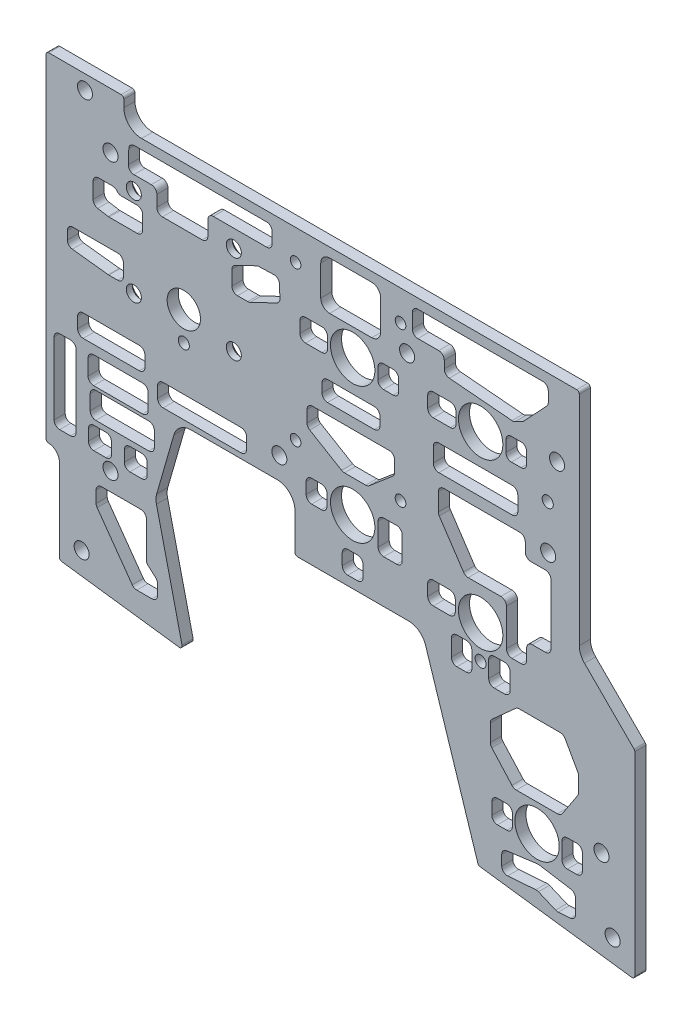
from build123d import *

# Parameters (mm, degrees)
BOSS_EXTRUDE1_DEPTH                       = 3.175
F_6_CLEARANCE_HOLE1_D                     = 4.3053
SKETCH4_R                                 = 6.35
SKETCH4_R_2                               = 1.5875
SKETCH4_R_3                               = 4.7625
CUT_EXTRUDE1_DEPTH                        = 218.405084842
CSK_FOR_6_FLAT_HEAD_MACHINE_SCREW_2_COUNT = 2
CSK_FOR_6_FLAT_HEAD_MACHINE_SCREW_2_PITCH = 28.575
CSK_FOR_6_FLAT_HEAD_MACHINE_SCREW_3_COUNT = 2
CSK_FOR_6_FLAT_HEAD_MACHINE_SCREW_3_PITCH = 38.232062788
CSK_FOR_6_FLAT_HEAD_MACHINE_SCREW_4_COUNT = 2
CSK_FOR_6_FLAT_HEAD_MACHINE_SCREW_4_PITCH = 25.4
F_0_CLEARANCE_HOLE1_D                     = 1.8542
F_1_8_0_125_DIAMETER_HOLE1_D              = 3.175
SKETCH17_R                                = 1.5875
BACKLIGHTING_HOLES_DEPTH                  = 218.405084842
SKETCH20_R                                = 1.52
SKETCH20_R_2                              = 1.520000008
SWITCH_PCB_MOUNTING_HOLES_DEPTH           = 218.405084844


with BuildPart() as part:
    # Sketch1 → Boss-Extrude1 (new body)
    with BuildSketch(Plane.XY):
        with BuildLine():
            Line((3.809986215, -91.884500325), (3.80998361, -115.403340545))
            ThreePointArc((3.80998361, -115.403340545), (3.999081622, -115.90576205), (4.472522544, -116.158821571))
            Line((4.472522544, -116.158821571), (38.023104274, -120.5758443))
            ThreePointArc((38.023104274, -120.5758443), (38.687459595, -120.33177166), (38.864463259, -119.646491316))
            Line((38.864463259, -119.646491316), (31.544635998, -88.413376307))
            ThreePointArc((31.544635998, -88.413376307), (31.412233483, -87.126289027), (31.609278422, -85.84750156))
            Line((31.609278422, -85.84750156), (36.533410401, -68.760772014))
            ThreePointArc((36.533410401, -68.760772014), (38.360231081, -66.108400459), (41.414754107, -65.0875))
            Line((41.414754107, -65.0875), (66.039990754, -65.0875))
            ThreePointArc((66.039990754, -65.0875), (69.632093202, -66.575397552), (71.119990754, -70.1675))
            Line((71.119990754, -70.1675), (71.119990754, -80.518))
            ThreePointArc((71.119990754, -80.518), (71.343175387, -81.056815367), (71.881990754, -81.28))
            Line((71.881990754, -81.28), (103.612235862, -81.28))
            ThreePointArc((103.612235862, -81.28), (106.604490402, -82.25478225), (108.448399818, -84.805034342))
            Line((108.448399818, -84.805034342), (123.423319929, -131.379161885))
            ThreePointArc((123.423319929, -131.379161885), (123.660593225, -131.731025839), (124.049283564, -131.901398021))
            Line((124.049283564, -131.901398021), (167.413526593, -137.610408921))
            ThreePointArc((167.413526593, -137.610408921), (168.015409063, -137.42782987), (168.274987552, -136.854927937))
            Line((168.274987552, -136.854927937), (168.274987552, -81.303553632))
            ThreePointArc((168.274987552, -81.303553632), (168.216983776, -81.011948907), (168.051802995, -80.764738341))
            Line((168.051802995, -80.764738341), (153.88788809, -66.600819412))
            ThreePointArc((153.88788809, -66.600819412), (152.786682817, -64.952748811), (152.399991049, -63.008717113))
            Line((152.399991049, -63.008717113), (152.399999892, -0.762021595))
            ThreePointArc((152.399999892, -0.762021595), (152.176815316, -0.223206231), (151.638, -2.1541e-05))
            Line((151.638, -2.1541e-05), (27.305, -3.804e-06))
            ThreePointArc((27.305, -3.804e-06), (23.712898123, 1.487894033), (22.22500087, 5.079996121))
            Line((22.22500087, 5.079996121), (22.225001755, 7.175496897))
            ThreePointArc((22.225001755, 7.175496897), (22.001816945, 7.7143128), (21.463001073, 7.937498421))
            Line((21.463001073, 7.937498421), (0.762001075, 7.937499892))
            ThreePointArc((0.762001075, 7.937499892), (0.223185691, 7.714315297), (1.021e-06, 7.175499945))
            Line((1.021e-06, 7.175499945), (-1.2342e-05, -87.949548922))
            ThreePointArc((-1.2342e-05, -87.949548922), (0.214550622, -88.479602508), (0.737406874, -88.711153328))
            ThreePointArc((0.737406874, -88.711153328), (2.915974038, -89.675944454), (3.809986215, -91.884500325))
        make_face()
    extrude(amount=-BOSS_EXTRUDE1_DEPTH)

    # #6 Clearance Hole1 (through all)
    with Locations(Plane(origin=(0, 0, -3.175), x_dir=(-1, 0, 0), z_dir=(0, 0, -1))):
        with Locations((-11.112500541, 3.81), (-18.414998872, -7.937503157), (-103.187497835, -15.240014658), (-143.510001128, -44.450020387), (-158.750001128, -111.125021649), (-18.414987678, -86.741003157), (-66.674991751, -58.7375), (-10.16, -110.502822935), (-146.049997068, -20.637520747), (-161.924987552, -130.483035149)):
            Hole(F_6_CLEARANCE_HOLE1_D / 2)

    # Sketch4 → Cut-Extrude1 (cut, through all)
    with BuildSketch(Plane(origin=(0, 0, -3.175), x_dir=(-1, 0, 0), z_dir=(0, 0, -1))):
        with Locations((-140.334987552, -115.57)):
            Circle(SKETCH4_R)
        with Locations((-124.205996572, -71.437521424)):
            Circle(SKETCH4_R)
        with Locations((-87.63, -62.992021649)):
            Circle(SKETCH4_R)
        with Locations((-87.63, -24.130021649)):
            Circle(SKETCH4_R)
        with Locations((-124.205996572, -24.130021649)):
            Circle(SKETCH4_R)
        with Locations((-124.205996572, -80.962521424)):
            Circle(SKETCH4_R_2)
        with Locations((-39.36999484, -36.322003157)):
            Circle(SKETCH4_R_3)
    extrude(amount=-CUT_EXTRUDE1_DEPTH, mode=Mode.SUBTRACT)

    # Sketch5 → CSK for #6 Flat Head Machine Screw (100)1 (revolve, cut)
    with BuildSketch(Plane(origin=(53.65749484, -14.097003157, -3.175), x_dir=(0, 1, 0), z_dir=(1, 0, 0))):
        Polygon((0, 0), (0, 3.175), (2.15265, 3.175), (2.15265, 1.420893136), (3.8460045, 0), align=None)
    csk_for_6_flat_head_machine_screw_100 = revolve(axis=Axis((53.65749484, -14.097003157, -9.525), (0, 0, 1)), mode=Mode.SUBTRACT)

    # CSK for _6 Flat Head Machine Screw _ 2: CSK for #6 Flat Head Machine Screw (100)1 ×2
    with Locations(*[(-i * CSK_FOR_6_FLAT_HEAD_MACHINE_SCREW_2_PITCH, 0, 0) for i in range(1, CSK_FOR_6_FLAT_HEAD_MACHINE_SCREW_2_COUNT)]):
        add(csk_for_6_flat_head_machine_screw_100, mode=Mode.SUBTRACT)

    # CSK for _6 Flat Head Machine Screw _ 3: CSK for #6 Flat Head Machine Screw (100)1 ×2
    with Locations(*[Vector(-0.7474093186836602, -0.6643638388299193, 0) * (i * CSK_FOR_6_FLAT_HEAD_MACHINE_SCREW_3_PITCH) for i in range(1, CSK_FOR_6_FLAT_HEAD_MACHINE_SCREW_3_COUNT)]):
        add(csk_for_6_flat_head_machine_screw_100, mode=Mode.SUBTRACT)

    # CSK for _6 Flat Head Machine Screw _ 4: CSK for #6 Flat Head Machine Screw (100)1 ×2
    with Locations(*[(0, -i * CSK_FOR_6_FLAT_HEAD_MACHINE_SCREW_4_PITCH, 0) for i in range(1, CSK_FOR_6_FLAT_HEAD_MACHINE_SCREW_4_COUNT)]):
        add(csk_for_6_flat_head_machine_screw_100, mode=Mode.SUBTRACT)

    # #0 Clearance Hole1 (through all)
    with Locations(Plane(origin=(0, 0, -9.525), x_dir=(-1, 0, 0), z_dir=(0, 0, -1))):
        with Locations((-39.36999484, -44.577003157)):
            Hole(F_0_CLEARANCE_HOLE1_D / 2)

    # 1/8 (0.125) Diameter Hole1 (through all)
    with Locations(Plane.XY):
        with Locations((39.36999484, -44.577003157)):
            Hole(F_1_8_0_125_DIAMETER_HOLE1_D / 2)

    # Sketch17 → Backlighting Holes (cut, through all)
    with BuildSketch(Plane(origin=(0, 0, 0), x_dir=(-1, 0, 0), z_dir=(0, 0, -1))):
        with Locations((-143.386523366, -31.863003467)):
            Circle(SKETCH17_R)
        with BuildLine():
            Line((-141.954401082, -2.794778722), (-106.266230354, -2.794778722))
            ThreePointArc((-106.266230354, -2.794778722), (-105.143698339, -3.259746707), (-104.678730354, -4.382278722))
            Line((-104.678730354, -4.382278722), (-104.678730354, -8.460645735))
            ThreePointArc((-104.678730354, -8.460645735), (-105.143698339, -9.58317775), (-106.266230354, -10.048145735))
            Line((-106.266230354, -10.048145735), (-112.220916292, -10.048145735))
            ThreePointArc((-112.220916292, -10.048145735), (-113.343448308, -10.513113719), (-113.808416292, -11.635645735))
            Line((-113.808416292, -11.635645735), (-113.808416292, -13.776242931))
            ThreePointArc((-113.808416292, -13.776242931), (-114.2259722, -14.849269991), (-115.258982682, -15.357826136))
            Line((-115.258982682, -15.357826136), (-133.159037644, -16.907614445))
            ThreePointArc((-133.159037644, -16.907614445), (-133.597603316, -16.884612116), (-134.01308492, -16.742330728))
            Line((-134.01308492, -16.742330728), (-136.087372049, -15.692058763))
            ThreePointArc((-136.087372049, -15.692058763), (-136.323169987, -15.545450468), (-136.529817195, -15.360000768))
            Line((-136.529817195, -15.360000768), (-143.113959892, -8.318487666))
            ThreePointArc((-143.113959892, -8.318487666), (-143.431045227, -7.817065459), (-143.541901082, -7.234246174))
            Line((-143.541901082, -7.234246174), (-143.541901082, -4.382278722))
            ThreePointArc((-143.541901082, -4.382278722), (-143.076933097, -3.259746707), (-141.954401082, -2.794778722))
        make_face()
        with BuildLine():
            Line((-93.066886854, -2.707621709), (-81.044131338, -2.707621709))
            ThreePointArc((-81.044131338, -2.707621709), (-79.248080114, -3.451570485), (-78.504131338, -5.247621709))
            Line((-78.504131338, -5.247621709), (-78.504131338, -13.895603213))
            ThreePointArc((-78.504131338, -13.895603213), (-79.248080114, -15.691654437), (-81.044131338, -16.435603213))
            Line((-81.044131338, -16.435603213), (-93.066886854, -16.435603213))
            ThreePointArc((-93.066886854, -16.435603213), (-94.862938078, -15.691654437), (-95.606886854, -13.895603213))
            Line((-95.606886854, -13.895603213), (-95.606886854, -5.247621709))
            ThreePointArc((-95.606886854, -5.247621709), (-94.862938078, -3.451570485), (-93.066886854, -2.707621709))
        make_face()
        with BuildLine():
            Line((-72.561223983, -22.437005333), (-72.561223983, -25.636983817))
            ThreePointArc((-72.561223983, -25.636983817), (-73.026191968, -26.759515832), (-74.148723983, -27.224483817))
            Line((-74.148723983, -27.224483817), (-78.851026484, -27.224483817))
            ThreePointArc((-78.851026484, -27.224483817), (-79.973558499, -26.759515832), (-80.438526484, -25.636983817))
            Line((-80.438526484, -25.636983817), (-80.438526484, -22.437005333))
            ThreePointArc((-80.438526484, -22.437005333), (-79.973558499, -21.314473318), (-78.851026484, -20.849505333))
            Line((-78.851026484, -20.849505333), (-74.148723983, -20.849505333))
            ThreePointArc((-74.148723983, -20.849505333), (-73.026191968, -21.314473318), (-72.561223983, -22.437005333))
        make_face()
        with BuildLine():
            Line((-99.201764697, -21.196263474), (-96.421279554, -21.196263474))
            ThreePointArc((-96.421279554, -21.196263474), (-95.298747539, -21.661231459), (-94.833779554, -22.783763474))
            Line((-94.833779554, -22.783763474), (-94.833779554, -25.981791856))
            ThreePointArc((-94.833779554, -25.981791856), (-95.298747539, -27.104323871), (-96.421279554, -27.569291856))
            Line((-96.421279554, -27.569291856), (-99.201764697, -27.569291856))
            ThreePointArc((-99.201764697, -27.569291856), (-100.324296712, -27.104323871), (-100.789264697, -25.981791856))
            Line((-100.789264697, -25.981791856), (-100.789264697, -22.783763474))
            ThreePointArc((-100.789264697, -22.783763474), (-100.324296712, -21.661231459), (-99.201764697, -21.196263474))
        make_face()
        with BuildLine():
            Line((-109.079202691, -22.654901792), (-109.079202691, -25.854880276))
            ThreePointArc((-109.079202691, -25.854880276), (-109.544170675, -26.977412291), (-110.666702691, -27.442380276))
            Line((-110.666702691, -27.442380276), (-115.553648816, -27.442380276))
            ThreePointArc((-115.553648816, -27.442380276), (-116.676180832, -26.977412291), (-117.141148816, -25.854880276))
            Line((-117.141148816, -25.854880276), (-117.141148816, -22.654901792))
            ThreePointArc((-117.141148816, -22.654901792), (-116.676180832, -21.532369777), (-115.553648816, -21.067401792))
            Line((-115.553648816, -21.067401792), (-110.666702691, -21.067401792))
            ThreePointArc((-110.666702691, -21.067401792), (-109.544170675, -21.532369777), (-109.079202691, -22.654901792))
        make_face()
        with BuildLine():
            Line((-135.77376345, -20.881443358), (-132.993278308, -20.881443358))
            ThreePointArc((-132.993278308, -20.881443358), (-131.870746293, -21.346411343), (-131.405778308, -22.468943358))
            Line((-131.405778308, -22.468943358), (-131.405778308, -25.666971739))
            ThreePointArc((-131.405778308, -25.666971739), (-131.870746293, -26.789503754), (-132.993278308, -27.254471739))
            Line((-132.993278308, -27.254471739), (-135.77376345, -27.254471739))
            ThreePointArc((-135.77376345, -27.254471739), (-136.896295465, -26.789503754), (-137.36126345, -25.666971739))
            Line((-137.36126345, -25.666971739), (-137.36126345, -22.468943358))
            ThreePointArc((-137.36126345, -22.468943358), (-136.896295465, -21.346411343), (-135.77376345, -20.881443358))
        make_face()
        with BuildLine():
            Line((-93.818924612, -33.08533813), (-80.438526484, -33.08533813))
            ThreePointArc((-80.438526484, -33.08533813), (-79.315994469, -33.550306115), (-78.851026484, -34.67283813))
            Line((-78.851026484, -34.67283813), (-78.851026484, -37.195409517))
            ThreePointArc((-78.851026484, -37.195409517), (-79.315994469, -38.317941532), (-80.438526484, -38.782909517))
            Line((-80.438526484, -38.782909517), (-93.818924612, -38.782909517))
            ThreePointArc((-93.818924612, -38.782909517), (-94.941456627, -38.317941532), (-95.406424612, -37.195409517))
            Line((-95.406424612, -37.195409517), (-95.406424612, -34.67283813))
            ThreePointArc((-95.406424612, -34.67283813), (-94.941456627, -33.550306115), (-93.818924612, -33.08533813))
        make_face()
        with BuildLine():
            Line((-133.234599807, -32.906340689), (-112.254202691, -32.906340689))
            ThreePointArc((-112.254202691, -32.906340689), (-111.131670675, -33.371308674), (-110.666702691, -34.493840689))
            Line((-110.666702691, -34.493840689), (-110.666702691, -38.654468066))
            ThreePointArc((-110.666702691, -38.654468066), (-111.131670675, -39.777000081), (-112.254202691, -40.241968066))
            Line((-112.254202691, -40.241968066), (-133.234599807, -40.241968066))
            ThreePointArc((-133.234599807, -40.241968066), (-134.357131822, -39.777000081), (-134.822099807, -38.654468066))
            Line((-134.822099807, -38.654468066), (-134.822099807, -34.493840689))
            ThreePointArc((-134.822099807, -34.493840689), (-134.357131822, -33.371308674), (-133.234599807, -32.906340689))
        make_face()
        with BuildLine():
            Line((-98.049772798, -41.846894397), (-76.171732084, -41.846894397))
            ThreePointArc((-76.171732084, -41.846894397), (-75.049200069, -42.311862382), (-74.584232084, -43.434394397))
            Line((-74.584232084, -43.434394397), (-74.584232084, -46.777135575))
            ThreePointArc((-74.584232084, -46.777135575), (-74.791626469, -47.561651185), (-75.359620735, -48.14118521))
            Line((-75.359620735, -48.14118521), (-84.465669031, -53.562633937))
            ThreePointArc((-84.465669031, -53.562633937), (-84.856634648, -53.729202648), (-85.277780379, -53.786084302))
            Line((-85.277780379, -53.786084302), (-91.347435578, -53.786084302))
            ThreePointArc((-91.347435578, -53.786084302), (-91.895147409, -53.68860712), (-92.375596997, -53.408146349))
            Line((-92.375596997, -53.408146349), (-99.077934217, -47.710973092))
            ThreePointArc((-99.077934217, -47.710973092), (-99.490668787, -47.167725534), (-99.637272798, -46.501411045))
            Line((-99.637272798, -46.501411045), (-99.637272798, -43.434394397))
            ThreePointArc((-99.637272798, -43.434394397), (-99.172304813, -42.311862382), (-98.049772798, -41.846894397))
        make_face()
        with BuildLine():
            Line((-135.378861596, -43.434394397), (-113.69903477, -43.434394397))
            ThreePointArc((-113.69903477, -43.434394397), (-112.576502755, -43.899362382), (-112.11153477, -45.021894397))
            Line((-112.11153477, -45.021894397), (-112.11153477, -50.042866363))
            ThreePointArc((-112.11153477, -50.042866363), (-112.179838766, -50.503517806), (-112.37887304, -50.924529143))
            Line((-112.37887304, -50.924529143), (-119.322930241, -61.322244422))
            ThreePointArc((-119.322930241, -61.322244422), (-119.894587933, -61.840545197), (-120.64309197, -62.028081642))
            Line((-120.64309197, -62.028081642), (-129.987144718, -62.028081642))
            ThreePointArc((-129.987144718, -62.028081642), (-131.109676734, -62.493049627), (-131.574644718, -63.615581642))
            Line((-131.574644718, -63.615581642), (-131.574644718, -74.171525295))
            ThreePointArc((-131.574644718, -74.171525295), (-132.039612703, -75.29405731), (-133.162144718, -75.759025295))
            Line((-133.162144718, -75.759025295), (-135.77376345, -75.759025295))
            ThreePointArc((-135.77376345, -75.759025295), (-136.896295465, -75.29405731), (-137.36126345, -74.171525295))
            Line((-137.36126345, -74.171525295), (-137.36126345, -71.06167269))
            ThreePointArc((-137.36126345, -71.06167269), (-137.826231435, -69.939140675), (-138.94876345, -69.47417269))
            Line((-138.94876345, -69.47417269), (-142.70584419, -69.47417269))
            ThreePointArc((-142.70584419, -69.47417269), (-143.828376205, -69.009204705), (-144.29334419, -67.88667269))
            Line((-144.29334419, -67.88667269), (-144.29334419, -50.696173086))
            ThreePointArc((-144.29334419, -50.696173086), (-143.828376205, -49.573641071), (-142.70584419, -49.108673086))
            Line((-142.70584419, -49.108673086), (-138.553861596, -49.108673086))
            ThreePointArc((-138.553861596, -49.108673086), (-137.431329581, -48.643705101), (-136.966361596, -47.521173086))
            Line((-136.966361596, -47.521173086), (-136.966361596, -45.021894397))
            ThreePointArc((-136.966361596, -45.021894397), (-136.501393611, -43.899362382), (-135.378861596, -43.434394397))
        make_face()
        with BuildLine():
            Line((-55.728459479, -57.317644253), (-33.458660867, -57.317644253))
            ThreePointArc((-33.458660867, -57.317644253), (-32.336128852, -57.782612238), (-31.871160867, -58.905144253))
            Line((-31.871160867, -58.905144253), (-31.871160867, -62.020016774))
            ThreePointArc((-31.871160867, -62.020016774), (-32.336128852, -63.142548789), (-33.458660867, -63.607516774))
            Line((-33.458660867, -63.607516774), (-55.728459479, -63.607516774))
            ThreePointArc((-55.728459479, -63.607516774), (-56.850991494, -63.142548789), (-57.315959479, -62.020016774))
            Line((-57.315959479, -62.020016774), (-57.315959479, -58.905144253))
            ThreePointArc((-57.315959479, -58.905144253), (-56.850991494, -57.782612238), (-55.728459479, -57.317644253))
        make_face()
        with BuildLine():
            Line((-78.702060135, -59.817431846), (-75.921574993, -59.817431846))
            ThreePointArc((-75.921574993, -59.817431846), (-74.799042977, -60.282399831), (-74.334074993, -61.404931846))
            Line((-74.334074993, -61.404931846), (-74.334074993, -64.602960227))
            ThreePointArc((-74.334074993, -64.602960227), (-74.799042977, -65.725492242), (-75.921574993, -66.190460227))
            Line((-75.921574993, -66.190460227), (-78.702060135, -66.190460227))
            ThreePointArc((-78.702060135, -66.190460227), (-79.82459215, -65.725492242), (-80.289560135, -64.602960227))
            Line((-80.289560135, -64.602960227), (-80.289560135, -61.404931846))
            ThreePointArc((-80.289560135, -61.404931846), (-79.82459215, -60.282399831), (-78.702060135, -59.817431846))
        make_face()
        with BuildLine():
            Line((-89.018858203, -72.254815082), (-86.23837306, -72.254815082))
            ThreePointArc((-86.23837306, -72.254815082), (-85.115841045, -72.719783067), (-84.65087306, -73.842315082))
            Line((-84.65087306, -73.842315082), (-84.65087306, -77.040343463))
            ThreePointArc((-84.65087306, -77.040343463), (-85.115841045, -78.162875478), (-86.23837306, -78.627843463))
            Line((-86.23837306, -78.627843463), (-89.018858203, -78.627843463))
            ThreePointArc((-89.018858203, -78.627843463), (-90.141390218, -78.162875478), (-90.606358203, -77.040343463))
            Line((-90.606358203, -77.040343463), (-90.606358203, -73.842315082))
            ThreePointArc((-90.606358203, -73.842315082), (-90.141390218, -72.719783067), (-89.018858203, -72.254815082))
        make_face()
        with BuildLine():
            Line((-109.075626661, -69.247984793), (-109.075626661, -72.447963277))
            ThreePointArc((-109.075626661, -72.447963277), (-109.540594645, -73.570495292), (-110.663126661, -74.035463277))
            Line((-110.663126661, -74.035463277), (-115.365429161, -74.035463277))
            ThreePointArc((-115.365429161, -74.035463277), (-116.487961176, -73.570495292), (-116.952929161, -72.447963277))
            Line((-116.952929161, -72.447963277), (-116.952929161, -69.247984793))
            ThreePointArc((-116.952929161, -69.247984793), (-116.487961176, -68.125452778), (-115.365429161, -67.660484793))
            Line((-115.365429161, -67.660484793), (-110.663126661, -67.660484793))
            ThreePointArc((-110.663126661, -67.660484793), (-109.540594645, -68.125452778), (-109.075626661, -69.247984793))
        make_face()
        with BuildLine():
            Line((-148.370050761, -88.076585208), (-151.957151361, -94.466108152))
            ThreePointArc((-151.957151361, -94.466108152), (-152.115789699, -94.859097254), (-152.169841465, -95.27943636))
            Line((-152.169841465, -95.27943636), (-152.169841465, -99.49161714))
            ThreePointArc((-152.169841465, -99.49161714), (-152.099935986, -99.968481356), (-151.89610216, -100.405217006))
            Line((-151.89610216, -100.405217006), (-147.55983031, -106.991698188))
            ThreePointArc((-147.55983031, -106.991698188), (-146.96032319, -107.540670714), (-146.17213864, -107.739529297))
            Line((-146.17213864, -107.739529297), (-134.392603774, -107.739529297))
            ThreePointArc((-134.392603774, -107.739529297), (-133.716535226, -107.595755795), (-133.157475142, -107.189318439))
            Line((-133.157475142, -107.189318439), (-127.395632153, -100.784991214))
            ThreePointArc((-127.395632153, -100.784991214), (-127.07956224, -100.268864333), (-126.96932981, -99.673771097))
            Line((-126.96932981, -99.673771097), (-126.96932981, -94.86683815))
            ThreePointArc((-126.96932981, -94.86683815), (-127.113103312, -94.190769602), (-127.519540668, -93.631709518))
            Line((-127.519540668, -93.631709518), (-134.162932699, -87.654784784))
            ThreePointArc((-134.162932699, -87.654784784), (-134.67905958, -87.338714871), (-135.274152816, -87.228482441))
            Line((-135.274152816, -87.228482441), (-146.92130989, -87.228482441))
            ThreePointArc((-146.92130989, -87.228482441), (-147.760673997, -87.456100045), (-148.370050761, -88.076585208))
        make_face()
        with BuildLine():
            Line((-132.626442112, -79.356885677), (-132.626442112, -84.055009483))
            ThreePointArc((-132.626442112, -84.055009483), (-132.161474127, -85.177541498), (-131.038942112, -85.642509483))
            Line((-131.038942112, -85.642509483), (-128.087367926, -85.642509483))
            ThreePointArc((-128.087367926, -85.642509483), (-126.964835911, -85.177541498), (-126.499867926, -84.055009483))
            Line((-126.499867926, -84.055009483), (-126.499867926, -79.36528336))
            ThreePointArc((-126.499867926, -79.36528336), (-126.963240164, -78.244349364), (-128.082851263, -77.777789785))
            Line((-128.082851263, -77.777789785), (-131.034425449, -77.769392102))
            ThreePointArc((-131.034425449, -77.769392102), (-132.159876108, -78.232757914), (-132.626442112, -79.356885677))
        make_face()
        with BuildLine():
            Line((-121.693780245, -79.413986581), (-121.693780245, -84.111339186))
            ThreePointArc((-121.693780245, -84.111339186), (-121.22881226, -85.233871201), (-120.106280245, -85.698839186))
            Line((-120.106280245, -85.698839186), (-117.42576388, -85.698839186))
            ThreePointArc((-117.42576388, -85.698839186), (-116.303231865, -85.233871201), (-115.83826388, -84.111339186))
            Line((-115.83826388, -84.111339186), (-115.83826388, -79.421613063))
            ThreePointArc((-115.83826388, -79.421613063), (-116.301636118, -78.300679067), (-117.421247217, -77.834119488))
            Line((-117.421247217, -77.834119488), (-120.101763581, -77.826493007))
            ThreePointArc((-120.101763581, -77.826493007), (-121.227214241, -78.289858819), (-121.693780245, -79.413986581))
        make_face()
        with BuildLine():
            Line((-101.797793639, -60.937531848), (-101.797793639, -67.347277648))
            ThreePointArc((-101.797793639, -67.347277648), (-101.332825654, -68.469809663), (-100.210293639, -68.934777648))
            Line((-100.210293639, -68.934777648), (-96.497621556, -68.934777648))
            ThreePointArc((-96.497621556, -68.934777648), (-95.375089541, -68.469809663), (-94.910121556, -67.347277648))
            Line((-94.910121556, -67.347277648), (-94.910121556, -60.948094972))
            ThreePointArc((-94.910121556, -60.948094972), (-95.373493794, -59.827160976), (-96.493104893, -59.360601397))
            Line((-96.493104893, -59.360601397), (-100.205776975, -59.350038274))
            ThreePointArc((-100.205776975, -59.350038274), (-101.331227635, -59.813404086), (-101.797793639, -60.937531848))
        make_face()
        with BuildLine():
            Line((-153.280142062, -113.845353265), (-153.280142062, -118.411545226))
            ThreePointArc((-153.280142062, -118.411545226), (-152.815174077, -119.534077241), (-151.692642062, -119.999045226))
            Line((-151.692642062, -119.999045226), (-149.012125698, -119.999045226))
            ThreePointArc((-149.012125698, -119.999045226), (-147.889593683, -119.534077241), (-147.424625698, -118.411545226))
            Line((-147.424625698, -118.411545226), (-147.424625698, -113.852979747))
            ThreePointArc((-147.424625698, -113.852979747), (-147.887997935, -112.732045751), (-149.007609034, -112.265486172))
            Line((-149.007609034, -112.265486172), (-151.688125399, -112.25785969))
            ThreePointArc((-151.688125399, -112.25785969), (-152.813576058, -112.721225502), (-153.280142062, -113.845353265))
        make_face()
        with BuildLine():
            Line((-133.269582538, -114.060259814), (-133.269582538, -117.452210954))
            ThreePointArc((-133.269582538, -117.452210954), (-132.804614553, -118.57474297), (-131.682082538, -119.039710954))
            Line((-131.682082538, -119.039710954), (-129.001566173, -119.039710954))
            ThreePointArc((-129.001566173, -119.039710954), (-127.879034158, -118.57474297), (-127.414066173, -117.452210954))
            Line((-127.414066173, -117.452210954), (-127.414066173, -114.067886296))
            ThreePointArc((-127.414066173, -114.067886296), (-127.877438411, -112.9469523), (-128.99704951, -112.480392721))
            Line((-128.99704951, -112.480392721), (-131.677565874, -112.47276624))
            ThreePointArc((-131.677565874, -112.47276624), (-132.803016533, -112.936132052), (-133.269582538, -114.060259814))
        make_face()
        with BuildLine():
            Line((-150.008386995, -124.475096267), (-140.89017679, -122.992460461))
            ThreePointArc((-140.89017679, -122.992460461), (-140.658124621, -122.972044218), (-140.425582982, -122.985807167))
            Line((-140.425582982, -122.985807167), (-131.613885455, -124.16070017))
            ThreePointArc((-131.613885455, -124.16070017), (-130.629285574, -124.688549111), (-130.23619536, -125.734274463))
            Line((-130.23619536, -125.734274463), (-130.23619536, -128.629666423))
            ThreePointArc((-130.23619536, -128.629666423), (-130.742753538, -129.792301803), (-131.939150985, -130.212962431))
            Line((-131.939150985, -130.212962431), (-139.978069251, -129.626755984))
            ThreePointArc((-139.978069251, -129.626755984), (-140.352556122, -129.64382753), (-140.712598595, -129.748236689))
            Line((-140.712598595, -129.748236689), (-145.647124424, -131.837991292))
            ThreePointArc((-145.647124424, -131.837991292), (-146.007166897, -131.94240045), (-146.381653768, -131.959471997))
            Line((-146.381653768, -131.959471997), (-149.869058718, -131.705166729))
            ThreePointArc((-149.869058718, -131.705166729), (-150.916238473, -131.202812543), (-151.341103093, -130.121870721))
            Line((-151.341103093, -130.121870721), (-151.341103093, -126.042017265))
            ThreePointArc((-151.341103093, -126.042017265), (-150.962864375, -125.01350212), (-150.008386995, -124.475096267))
        make_face()
        with BuildLine():
            Line((-63.040443501, -2.794778722), (-25.227680135, -2.794778722))
            ThreePointArc((-25.227680135, -2.794778722), (-24.123242224, -3.241939671), (-23.640992035, -4.331513335))
            Line((-23.640992035, -4.331513335), (-23.510506479, -8.409880348))
            ThreePointArc((-23.510506479, -8.409880348), (-23.956855528, -9.565083646), (-25.097194578, -10.048145735))
            Line((-25.097194578, -10.048145735), (-30.072502828, -10.048145735))
            ThreePointArc((-30.072502828, -10.048145735), (-31.195034843, -10.513113719), (-31.660002828, -11.635645735))
            Line((-31.660002828, -11.635645735), (-31.660002828, -14.848103213))
            ThreePointArc((-31.660002828, -14.848103213), (-32.124970813, -15.970635228), (-33.247502828, -16.435603213))
            Line((-33.247502828, -16.435603213), (-44.640077745, -16.435603213))
            ThreePointArc((-44.640077745, -16.435603213), (-45.76260976, -15.970635228), (-46.227577745, -14.848103213))
            Line((-46.227577745, -14.848103213), (-46.227577745, -10.622419331))
            ThreePointArc((-46.227577745, -10.622419331), (-46.69254573, -9.499887316), (-47.815077745, -9.034919331))
            Line((-47.815077745, -9.034919331), (-63.040443501, -9.034919331))
            ThreePointArc((-63.040443501, -9.034919331), (-64.162975516, -8.569951347), (-64.627943501, -7.447419331))
            Line((-64.627943501, -7.447419331), (-64.627943501, -4.382278722))
            ThreePointArc((-64.627943501, -4.382278722), (-64.162975516, -3.259746707), (-63.040443501, -2.794778722))
        make_face()
        with BuildLine():
            Line((-14.759070115, -23.570795807), (-17.723350514, -24.090332102))
            ThreePointArc((-17.723350514, -24.090332102), (-17.85986161, -24.1081969), (-17.997407205, -24.114166799))
            Line((-17.997407205, -24.114166799), (-26.038134643, -24.114166799))
            ThreePointArc((-26.038134643, -24.114166799), (-27.160666659, -23.649198814), (-27.625634643, -22.526666799))
            Line((-27.625634643, -22.526666799), (-27.625634643, -18.73663863))
            ThreePointArc((-27.625634643, -18.73663863), (-27.160666659, -17.614106615), (-26.038134643, -17.14913863))
            Line((-26.038134643, -17.14913863), (-21.56318401, -17.14913863))
            ThreePointArc((-21.56318401, -17.14913863), (-20.962036583, -17.030916691), (-20.45042467, -16.693858971))
            Line((-20.45042467, -16.693858971), (-20.120376939, -16.369484217))
            ThreePointArc((-20.120376939, -16.369484217), (-19.608765026, -16.032426497), (-19.007617599, -15.914204558))
            Line((-19.007617599, -15.914204558), (-15.033126806, -15.914204558))
            ThreePointArc((-15.033126806, -15.914204558), (-13.910594791, -16.379172543), (-13.445626806, -17.501704558))
            Line((-13.445626806, -17.501704558), (-13.445626806, -22.007130504))
            ThreePointArc((-13.445626806, -22.007130504), (-13.817556725, -23.02818174), (-14.759070115, -23.570795807))
        make_face()
        with BuildLine():
            Line((-7.687541654, -31.784293999), (-20.492686013, -31.784293999))
            ThreePointArc((-20.492686013, -31.784293999), (-21.615218028, -32.249261984), (-22.080186013, -33.371793999))
            Line((-22.080186013, -33.371793999), (-22.080186013, -36.910471607))
            ThreePointArc((-22.080186013, -36.910471607), (-21.615218028, -38.033003622), (-20.492686013, -38.497971607))
            Line((-20.492686013, -38.497971607), (-17.950353288, -38.497971607))
            ThreePointArc((-17.950353288, -38.497971607), (-17.85932805, -38.495359823), (-17.768602325, -38.487533064))
            Line((-17.768602325, -38.487533064), (-7.505790692, -37.304778971))
            ThreePointArc((-7.505790692, -37.304778971), (-6.502491887, -36.784038157), (-6.100041654, -35.727717515))
            Line((-6.100041654, -35.727717515), (-6.100041654, -33.371793999))
            ThreePointArc((-6.100041654, -33.371793999), (-6.565009639, -32.249261984), (-7.687541654, -31.784293999))
        make_face()
        with BuildLine():
            Line((-54.017740764, -18.035287573), (-60.157042526, -15.096331818))
            ThreePointArc((-60.157042526, -15.096331818), (-60.467014119, -14.985764634), (-60.793122931, -14.941486718))
            Line((-60.793122931, -14.941486718), (-65.080511102, -14.808059257))
            ThreePointArc((-65.080511102, -14.808059257), (-66.216963147, -15.237884918), (-66.716623456, -16.345410507))
            Line((-66.716623456, -16.345410507), (-66.828160076, -19.929386283))
            ThreePointArc((-66.828160076, -19.929386283), (-66.597618952, -20.803935361), (-65.926889232, -21.410653537))
            Line((-65.926889232, -21.410653537), (-58.302186243, -25.06068828))
            ThreePointArc((-58.302186243, -25.06068828), (-57.968176642, -25.176909518), (-57.616725286, -25.216301578))
            Line((-57.616725286, -25.216301578), (-54.703201722, -25.216301578))
            ThreePointArc((-54.703201722, -25.216301578), (-53.580669707, -24.751333593), (-53.115701722, -23.628801578))
            Line((-53.115701722, -23.628801578), (-53.115701722, -19.467174274))
            ThreePointArc((-53.115701722, -19.467174274), (-53.360010462, -18.621010289), (-54.017740764, -18.035287573))
        make_face()
        with BuildLine():
            Line((-24.6224405, -111.814164533), (-14.598619876, -97.7476148))
            ThreePointArc((-14.598619876, -97.7476148), (-14.379412328, -97.309967584), (-14.303951845, -96.826342988))
            Line((-14.303951845, -96.826342988), (-14.303951845, -93.511282851))
            ThreePointArc((-14.303951845, -93.511282851), (-14.76891983, -92.388750836), (-15.891451845, -91.923782851))
            Line((-15.891451845, -91.923782851), (-27.085798239, -91.923782851))
            ThreePointArc((-27.085798239, -91.923782851), (-28.208330254, -92.388750836), (-28.673298239, -93.511282851))
            Line((-28.673298239, -93.511282851), (-28.673298239, -103.655996614))
            ThreePointArc((-28.673298239, -103.655996614), (-28.814136203, -104.309697772), (-29.2116607, -104.847410343))
            Line((-29.2116607, -104.847410343), (-31.332798405, -106.715246122))
            ThreePointArc((-31.332798405, -106.715246122), (-31.730322903, -107.252958694), (-31.871160867, -107.906659851))
            Line((-31.871160867, -107.906659851), (-31.871160867, -110.892892721))
            ThreePointArc((-31.871160867, -110.892892721), (-31.406192882, -112.015424736), (-30.283660867, -112.480392721))
            Line((-30.283660867, -112.480392721), (-25.915272469, -112.480392721))
            ThreePointArc((-25.915272469, -112.480392721), (-25.188073304, -112.304040348), (-24.6224405, -111.814164533))
        make_face()
        with BuildLine():
            Line((-2.29761601, -61.626856011), (-2.29761601, -82.185869764))
            ThreePointArc((-2.29761601, -82.185869764), (-2.762583995, -83.308401779), (-3.88511601, -83.773369764))
            Line((-3.88511601, -83.773369764), (-6.992649062, -83.773369764))
            ThreePointArc((-6.992649062, -83.773369764), (-8.115181078, -83.308401779), (-8.580149062, -82.185869764))
            Line((-8.580149062, -82.185869764), (-8.580149062, -61.626856011))
            ThreePointArc((-8.580149062, -61.626856011), (-8.115181078, -60.504323996), (-6.992649062, -60.039356011))
            Line((-6.992649062, -60.039356011), (-3.88511601, -60.039356011))
            ThreePointArc((-3.88511601, -60.039356011), (-2.762583995, -60.504323996), (-2.29761601, -61.626856011))
        make_face()
        with BuildLine():
            Line((-26.655047824, -51.539248395), (-10.603917238, -51.539248395))
            ThreePointArc((-10.603917238, -51.539248395), (-9.481385223, -52.00421638), (-9.016417238, -53.126748395))
            Line((-9.016417238, -53.126748395), (-9.016417238, -56.241620915))
            ThreePointArc((-9.016417238, -56.241620915), (-9.481385223, -57.364152931), (-10.603917238, -57.829120915))
            Line((-10.603917238, -57.829120915), (-26.655047824, -57.829120915))
            ThreePointArc((-26.655047824, -57.829120915), (-27.777579839, -57.364152931), (-28.242547824, -56.241620915))
            Line((-28.242547824, -56.241620915), (-28.242547824, -53.126748395))
            ThreePointArc((-28.242547824, -53.126748395), (-27.777579839, -52.00421638), (-26.655047824, -51.539248395))
        make_face()
        with BuildLine():
            Line((-27.60517637, -60.384955933), (-13.586583905, -60.384955933))
            ThreePointArc((-13.586583905, -60.384955933), (-12.464051889, -60.849923918), (-11.999083905, -61.972455933))
            Line((-11.999083905, -61.972455933), (-11.999083905, -66.454374219))
            ThreePointArc((-11.999083905, -66.454374219), (-12.464051889, -67.576906234), (-13.586583905, -68.041874219))
            Line((-13.586583905, -68.041874219), (-27.60517637, -68.041874219))
            ThreePointArc((-27.60517637, -68.041874219), (-28.727708385, -67.576906234), (-29.19267637, -66.454374219))
            Line((-29.19267637, -66.454374219), (-29.19267637, -61.972455933))
            ThreePointArc((-29.19267637, -61.972455933), (-28.727708385, -60.849923918), (-27.60517637, -60.384955933))
        make_face()
        with BuildLine():
            Line((-29.346999145, -68.903193864), (-14.201372964, -68.903193864))
            ThreePointArc((-14.201372964, -68.903193864), (-13.078840949, -69.368161849), (-12.613872964, -70.490693864))
            Line((-12.613872964, -70.490693864), (-12.613872964, -74.741182613))
            ThreePointArc((-12.613872964, -74.741182613), (-13.078840949, -75.863714628), (-14.201372964, -76.328682613))
            Line((-14.201372964, -76.328682613), (-29.346999145, -76.328682613))
            ThreePointArc((-29.346999145, -76.328682613), (-30.46953116, -75.863714628), (-30.934499145, -74.741182613))
            Line((-30.934499145, -74.741182613), (-30.934499145, -70.490693864))
            ThreePointArc((-30.934499145, -70.490693864), (-30.46953116, -69.368161849), (-29.346999145, -68.903193864))
        make_face()
        with BuildLine():
            Line((-27.328678764, -77.907601358), (-23.948133638, -77.907601358))
            ThreePointArc((-23.948133638, -77.907601358), (-22.825601623, -78.372569343), (-22.360633638, -79.495101358))
            Line((-22.360633638, -79.495101358), (-22.360633638, -82.609973878))
            ThreePointArc((-22.360633638, -82.609973878), (-22.825601623, -83.732505893), (-23.948133638, -84.197473878))
            Line((-23.948133638, -84.197473878), (-27.328678764, -84.197473878))
            ThreePointArc((-27.328678764, -84.197473878), (-28.45121078, -83.732505893), (-28.916178764, -82.609973878))
            Line((-28.916178764, -82.609973878), (-28.916178764, -79.495101358))
            ThreePointArc((-28.916178764, -79.495101358), (-28.45121078, -78.372569343), (-27.328678764, -77.907601358))
        make_face()
        with BuildLine():
            Line((-17.11922324, -77.821029951), (-13.667032811, -77.821029951))
            ThreePointArc((-13.667032811, -77.821029951), (-12.544500796, -78.285997936), (-12.079532811, -79.408529951))
            Line((-12.079532811, -79.408529951), (-12.079532811, -82.523402472))
            ThreePointArc((-12.079532811, -82.523402472), (-12.544500796, -83.645934487), (-13.667032811, -84.110902472))
            Line((-13.667032811, -84.110902472), (-17.11922324, -84.110902472))
            ThreePointArc((-17.11922324, -84.110902472), (-18.241755255, -83.645934487), (-18.70672324, -82.523402472))
            Line((-18.70672324, -82.523402472), (-18.70672324, -79.408529951))
            ThreePointArc((-18.70672324, -79.408529951), (-18.241755255, -78.285997936), (-17.11922324, -77.821029951))
        make_face()
    extrude(amount=BACKLIGHTING_HOLES_DEPTH, mode=Mode.SUBTRACT)

    # Sketch20 → Switch PCB Mounting Holes (cut, through all)
    with BuildSketch(Plane.XY):
        with Locations((101.311694799, -8.663003362)):
            Circle(SKETCH20_R)
        with Locations((71.311694799, -8.663003362)):
            Circle(SKETCH20_R_2)
        with Locations((101.311694799, -52.663003362)):
            Circle(SKETCH20_R_2)
        with Locations((71.311694799, -52.663003362)):
            Circle(SKETCH20_R_2)
    extrude(amount=-SWITCH_PCB_MOUNTING_HOLES_DEPTH, mode=Mode.SUBTRACT)


solid = part.part
